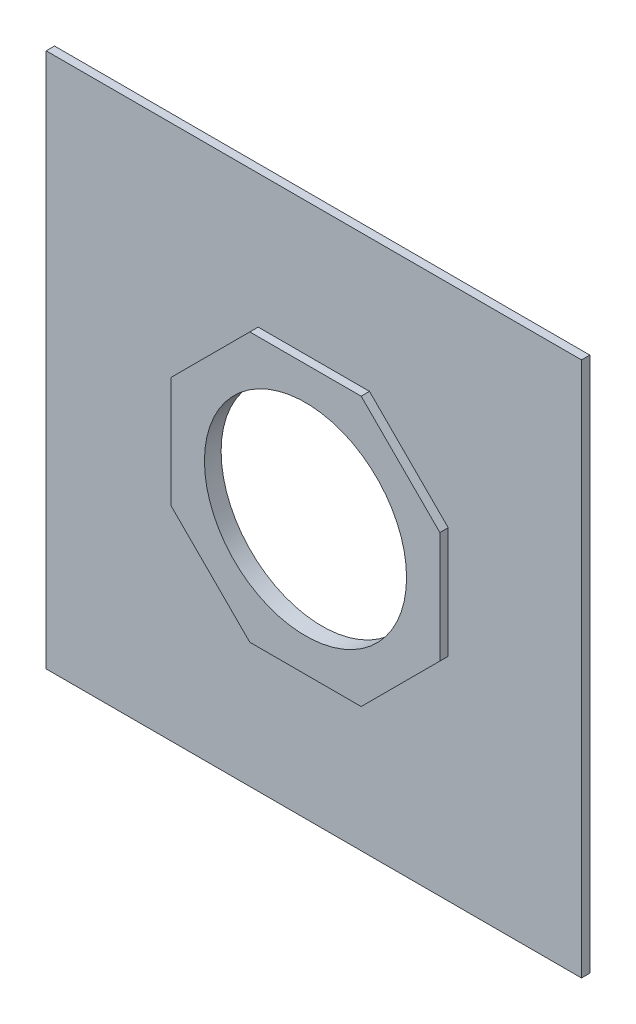
from build123d import *

# Parameters (mm, degrees)
SKETCH1_W           = 203.947710216
SKETCH1_H           = 203.947710216
SKETCH1_R           = 38.5
BOSS_EXTRUDE1_DEPTH = 3.175
SKETCH1_3_R         = 38.5
BOSS_EXTRUDE2_DEPTH = 6.35


with BuildPart() as part:
    # Sketch1 → Boss-Extrude1 (new body)
    with BuildSketch(Plane.XY):
        Rectangle(SKETCH1_W, SKETCH1_H)
        Circle(SKETCH1_R, mode=Mode.SUBTRACT)
    extrude(amount=BOSS_EXTRUDE1_DEPTH)

    # Sketch1<3> → Boss-Extrude2 (add)
    with BuildSketch(Plane.XY):
        Polygon((51.2, 21.207734394), (21.207734394, 51.2), (-21.207734394, 51.2), (-51.2, 21.207734394), (-51.2, -21.207734394), (-21.207734394, -51.2), (21.207734394, -51.2), (51.2, -21.207734394), align=None)
        Circle(SKETCH1_3_R, mode=Mode.SUBTRACT)
    extrude(amount=BOSS_EXTRUDE2_DEPTH)


solid = part.part
